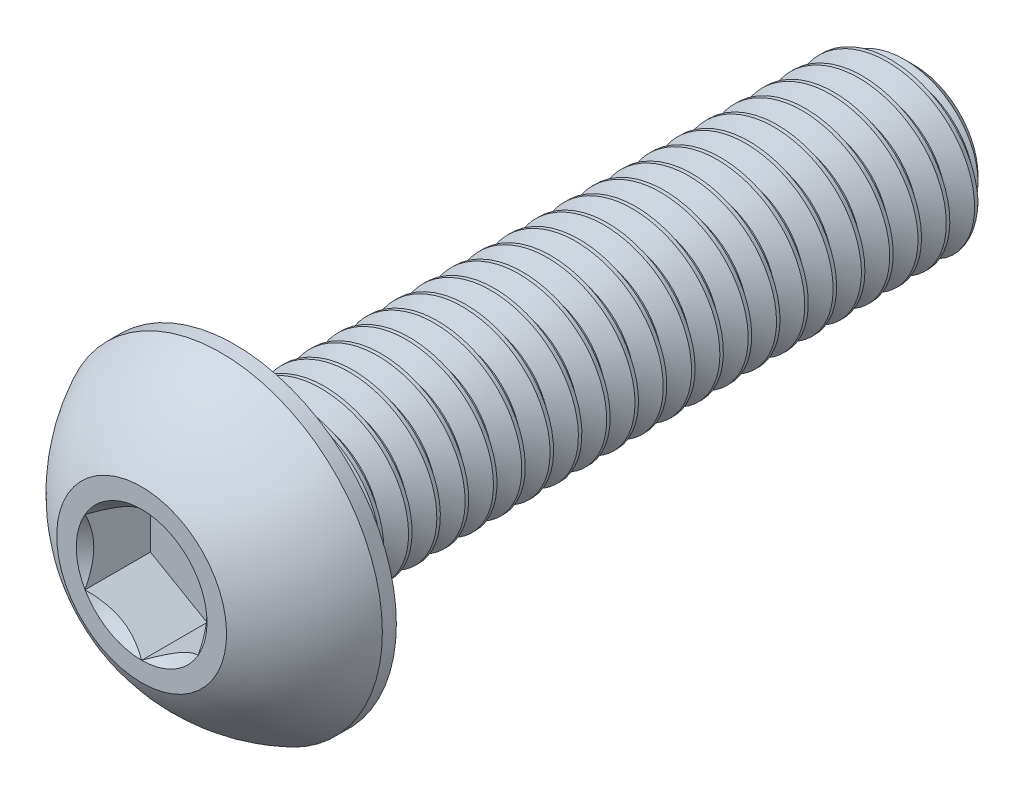
from build123d import *

# Parameters (mm, degrees)
SKETCH1_W              = 12
SKETCH1_H              = 1.5
CUT_EXTRUDE2_DEPTH     = 1.155
SPLIT1_SURFACE_1_BACK  = 16.853
SPLIT1_SURFACE_1_DEPTH = 33.706
SPLIT1_SURFACE_2_BACK  = 16.853
SPLIT1_SURFACE_2_DEPTH = 33.706
CHAMFER1_SIZE          = 0.375
CUT_SWEEP1_PITCH       = 0.5
CUT_SWEEP1_TO          = 12


with BuildPart() as part:
    # Sketch1 → Revolve1 (revolve)
    with BuildSketch(Plane(origin=(0, 0, 0), x_dir=(0, 0, -1), z_dir=(1, 0, 0))):
        with Locations((7.65, 0.75)):
            Rectangle(SKETCH1_W, SKETCH1_H)
    revolve(axis=Axis((0, 0, -13.65), (0, 0, 1)))

    # Sketch7 → Revolve2 (revolve)
    with BuildSketch(Plane(origin=(0, 0, 0), x_dir=(0, 0, -1), z_dir=(1, 0, 0)), mode=Mode.PRIVATE) as revolve2_sk:
        with BuildLine():
            Line((1.4025, 2.85), (1.65, 2.85))
            Line((1.65, 2.85), (1.65, 0))
            Line((1.65, 0), (0, 0))
            Line((0, 0), (0, 1.5))
            ThreePointArc((0, 1.5), (0.59512511, 2.285251969), (1.4025, 2.85))
        make_face()
    revolve(revolve2_sk.sketch.rotate(Axis((0, 0, 0), (0, 0, -1)), 180), axis=Axis((0, 0, 0), (0, 0, -1)))

    # Sketch5 → Cut-Extrude2 (cut)
    with BuildSketch(Plane.XY):
        Polygon((1, -0.577350269), (1, 0.577350269), (0, 1.154700538), (-1, 0.577350269), (-1, -0.577350269), (0, -1.154700538), align=None)
    extrude(amount=-CUT_EXTRUDE2_DEPTH, mode=Mode.SUBTRACT)

    # Cut-Extrude3 cone 1 section (through the dimple's axis) → Cut-Extrude3 (revolve, cut)
    with BuildSketch(Plane(origin=(0, 0, 0), x_dir=(0, -1, 0), z_dir=(1, 0, 0))):
        Polygon((0, 0), (1.154700538, 0), (0, 1.154700538), align=None)
    revolve(axis=Axis((0, 0, 0), (0, 0, -1)), mode=Mode.SUBTRACT)


with BuildPart() as body_2:
    # Split1: the piece behind the surface
    add(part.part)
    # Split1 surface: a surface, the sketch's curves swept straight by 33.706 mm
    with BuildLine(Plane(origin=(0, 0, 0), x_dir=(0, 0, -1), z_dir=(1, 0, 0)).offset(-SPLIT1_SURFACE_1_BACK), mode=Mode.PRIVATE) as split1_surface_1_path:
        Line((1.65, -2.85), (1.65, 2.85))
    split1_surface_1 = Shell.extrude(split1_surface_1_path.wire(), (1 * SPLIT1_SURFACE_1_DEPTH, 0 * SPLIT1_SURFACE_1_DEPTH, 0 * SPLIT1_SURFACE_1_DEPTH))
    split(bisect_by=split1_surface_1, keep=Keep.BOTTOM)

    # Chamfer1
    chamfer1_edges = [body_2.edges().sort_by_distance(p)[0] for p in [
        (0, -1.5, -13.65),
    ]]
    chamfer(chamfer1_edges, length=CHAMFER1_SIZE)

    # Cut-Sweep1: arcs per turn and ends read off the stored shape
    # Cut-Sweep1: the profile of Sketch2 screwed along a right-hand helix through 25 turns, 6 arcs to a turn; built about Z, then put on its axis
    cut_sweep1_z = Axis((0, 0, 0), (0, 0, 1))
    cut_sweep1_corners = [(1.175240474, 0, -0.1875), (1.175240474, 0, -0.25), (1.527063294, 0, -0.453125), (1.527063294, 0, 0.015625)]
    with BuildLine(mode=Mode.PRIVATE) as cut_sweep1_profile:
        Line(cut_sweep1_corners[0], cut_sweep1_corners[1])
        Line(cut_sweep1_corners[1], cut_sweep1_corners[2])
        Line(cut_sweep1_corners[2], cut_sweep1_corners[3])
        Line(cut_sweep1_corners[3], cut_sweep1_corners[0])
    cut_sweep1_cap = Face(cut_sweep1_profile.wire())
    cut_sweep1_turn_angles = [0, 30, 60, 90, 120, 150, 180, 210, 240, 270, 300, 330, 360]
    cut_sweep1_turn_weights = [1, 0.8660254037844387, 1, 0.8660254037844387, 1, 0.8660254037844387, 1, 0.8660254037844387, 1, 0.8660254037844387, 1, 0.8660254037844387, 1]
    cut_sweep1_turn_rails = [Edge.make_bspline([Vector(p[0], p[1], 0).rotate(cut_sweep1_z, cut_sweep1_turn_angles[k]) / cut_sweep1_turn_weights[k] + Vector(0, 0, p[2] + CUT_SWEEP1_PITCH * cut_sweep1_turn_angles[k] / 360) for k in range(13)], [0, 0, 0, 1, 1, 2, 2, 3, 3, 4, 4, 5, 5, 6, 6, 6], 2, cut_sweep1_turn_weights) for p in cut_sweep1_corners]
    cut_sweep1_turn_sides = [Face.make_surface_from_curves(cut_sweep1_turn_rails[p[0]], cut_sweep1_turn_rails[p[1]]) for p in [(0, 1), (1, 2), (2, 3), (3, 0)]]
    cut_sweep1 = Plane(origin=(0, 0, -13.65), x_dir=(0, 1, 0), z_dir=(0, 0, 1)) * split(Solid(Shell([*[p.moved(Location((0, 0, CUT_SWEEP1_PITCH * i))) for i in range(25) for p in cut_sweep1_turn_sides], cut_sweep1_cap, cut_sweep1_cap.rotate(cut_sweep1_z, 9000).moved(Location((0, 0, CUT_SWEEP1_PITCH * 9000 / 360)))])), bisect_by=Plane.XY.offset(CUT_SWEEP1_TO), keep=Keep.BOTTOM, mode=Mode.PRIVATE)
    add(cut_sweep1, mode=Mode.SUBTRACT)


with BuildPart() as part_1:
    add(part.part)

    # Split1: split by a surface, the side it looks to stays
    # Split1 surface: a surface, the sketch's curves swept straight by 33.706 mm
    with BuildLine(Plane(origin=(0, 0, 0), x_dir=(0, 0, -1), z_dir=(1, 0, 0)).offset(-SPLIT1_SURFACE_2_BACK), mode=Mode.PRIVATE) as split1_surface_2_path:
        Line((1.65, -2.85), (1.65, 2.85))
    split1_surface_2 = Shell.extrude(split1_surface_2_path.wire(), (1 * SPLIT1_SURFACE_2_DEPTH, 0 * SPLIT1_SURFACE_2_DEPTH, 0 * SPLIT1_SURFACE_2_DEPTH))
    split(bisect_by=split1_surface_2, keep=Keep.TOP)

    # Combine1: union body 2
    add(body_2.part)


solid = part_1.part
